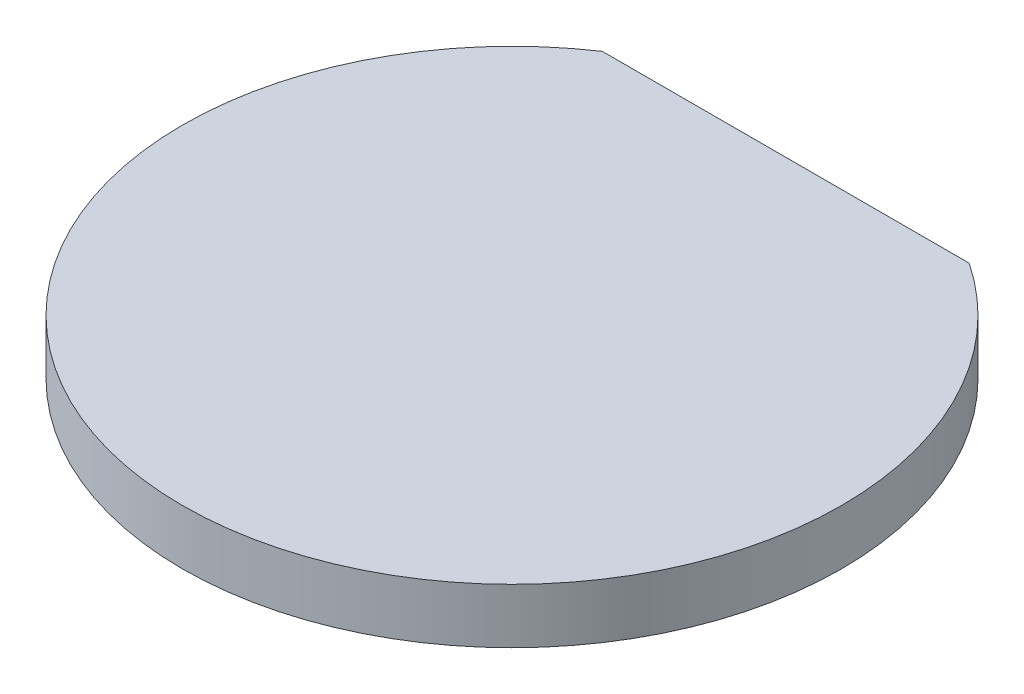
from build123d import *

# Parameters (mm, degrees)
SKETCH1_R               = 38.1
BOSS_EXTRUDE1_DEPTH     = 6.35
CUT_EXTRUDE1_DEPTH      = 55.254423783
CUT_EXTRUDE1_DEPTH_BACK = 55.254423783


with BuildPart() as part:
    # Sketch1 → Boss-Extrude1 (new body)
    with BuildSketch(Plane(origin=(0, 0, 0), x_dir=(1, 0, 0), z_dir=(0, 1, 0))):
        Circle(SKETCH1_R)
    extrude(amount=BOSS_EXTRUDE1_DEPTH)

    # Sketch2 → Cut-Extrude1 (cut, two sides: drawn at the far end of the back side and taken through both)
    with BuildSketch(Plane(origin=(0, 6.35, 0), x_dir=(1, 0, 0), z_dir=(0, 1, 0)).offset(-CUT_EXTRUDE1_DEPTH_BACK)):
        with BuildLine():
            Line((-21.209, 31.651039778), (21.209, 31.651039778))
            ThreePointArc((21.209, 31.651039778), (0, 38.1), (-21.209, 31.651039778))
        make_face()
    extrude(amount=CUT_EXTRUDE1_DEPTH + CUT_EXTRUDE1_DEPTH_BACK, mode=Mode.SUBTRACT)


solid = part.part
